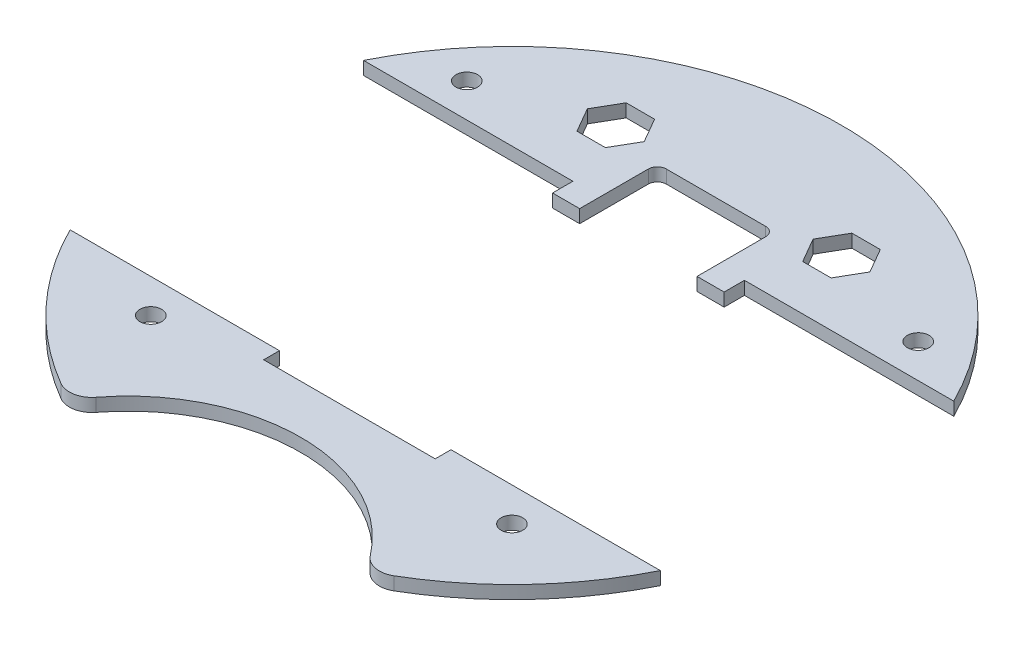
from build123d import *

# Parameters (mm, degrees)
BOSS_EXTRUDE1_DEPTH  = 2.9
SOLENOID_PLACEMENT_W = 38
SOLENOID_PLACEMENT_H = 64
CUT_EXTRUDE1_DEPTH   = 104.278313309
CUT_EXTRUDE5_DEPTH   = 104.278313309
SKETCH6_R            = 2.4
CUT_EXTRUDE6_DEPTH   = 104.278313309
CUT_EXTRUDE3_DEPTH   = 104.278313309
CUT_EXTRUDE7_DEPTH   = 99.031423533


with BuildPart() as part:
    # Sketch1 → Boss-Extrude1 (new body)
    with BuildSketch(Plane(origin=(0, 0, 0), x_dir=(1, 0, 0), z_dir=(0, 1, 0))):
        with BuildLine():
            ThreePointArc((36.856602833, -63.012624351), (0, 73), (-36.856602833, -63.012624351))
            ThreePointArc((-36.856602833, -63.012624351), (-33.368752207, -63.602994345), (-30.363140064, -61.737536127))
            ThreePointArc((-30.363140064, -61.737536127), (0, -46.75), (30.363140064, -61.737536127))
            ThreePointArc((30.363140064, -61.737536127), (33.368752207, -63.602994345), (36.856602833, -63.012624351))
        make_face()
    extrude(amount=BOSS_EXTRUDE1_DEPTH)

    # solenoid placement → Cut-Extrude1 (cut, through all)
    with BuildSketch(Plane(origin=(0, 2.9, 0), x_dir=(1, 0, 0), z_dir=(0, 1, 0))):
        with Locations((0, -4)):
            Rectangle(SOLENOID_PLACEMENT_W, SOLENOID_PLACEMENT_H)
    extrude(amount=-CUT_EXTRUDE1_DEPTH, mode=Mode.SUBTRACT)

    # Sketch5 → Cut-Extrude5 (cut, through all)
    with BuildSketch(Plane(origin=(0, 2.9, 0), x_dir=(1, 0, 0), z_dir=(0, 1, 0))):
        Polygon((-18.706882066, 48), (-21.853441033, 53.45), (-28.146558967, 53.45), (-31.293117934, 48), (-28.146558967, 42.55), (-21.853441033, 42.55), align=None)
        Polygon((18.706882066, 48), (21.853441033, 42.55), (28.146558967, 42.55), (31.293117934, 48), (28.146558967, 53.45), (21.853441033, 53.45), align=None)
    extrude(amount=-CUT_EXTRUDE5_DEPTH, mode=Mode.SUBTRACT)

    # Sketch6 → Cut-Extrude6 (cut, through all)
    with BuildSketch(Plane(origin=(0, 2.9, 0), x_dir=(1, 0, 0), z_dir=(0, 1, 0))):
        with Locations((40, -40)):
            Circle(SKETCH6_R)
        with Locations((-40, -40)):
            Circle(SKETCH6_R)
        with Locations((-50, 40)):
            Circle(SKETCH6_R)
        with Locations((50, 40)):
            Circle(SKETCH6_R)
    extrude(amount=-CUT_EXTRUDE6_DEPTH, mode=Mode.SUBTRACT)

    # Sketch3 → Cut-Extrude3 (cut, through all)
    with BuildSketch(Plane(origin=(0, 2.9, 0), x_dir=(1, 0, 0), z_dir=(0, 1, 0))):
        Polygon((-19, 28), (-19, 32.5), (-73, 32.5), (-73, -32.5), (73, -32.5), (73, 32.5), (19, 32.5), (19, 28), align=None)
    extrude(amount=-CUT_EXTRUDE3_DEPTH, mode=Mode.SUBTRACT)


with BuildPart() as cut_extrude3_piece_1:
    # of the separate pieces the step leaves, piece 1, a body of its own (cut_extrude3_pieces)
    add(part.part.solids().sort_by_distance((65.366275709, 0, -32.5))[0])

    # Sketch7 → Cut-Extrude7 (cut, through all)
    with BuildSketch(Plane(origin=(0, 2.9, 0), x_dir=(1, 0, 0), z_dir=(0, 1, 0))):
        with BuildLine():
            Line((-13, 28), (13, 28))
            Line((13, 28), (13, 43.2))
            ThreePointArc((13, 43.2), (12.414213562, 44.614213562), (11, 45.2))
            Line((11, 45.2), (-11, 45.2))
            ThreePointArc((-11, 45.2), (-12.414213562, 44.614213562), (-13, 43.2))
            Line((-13, 43.2), (-13, 28))
        make_face()
    extrude(amount=-CUT_EXTRUDE7_DEPTH, mode=Mode.SUBTRACT)


with BuildPart() as cut_extrude3_piece_2:
    # of the separate pieces the step leaves, piece 2, a body of its own (cut_extrude3_pieces)
    add(part.part.solids().sort_by_distance((-36.856602833, 0, 63.012624351))[0])


solid = Compound([cut_extrude3_piece_1.part, cut_extrude3_piece_2.part])
